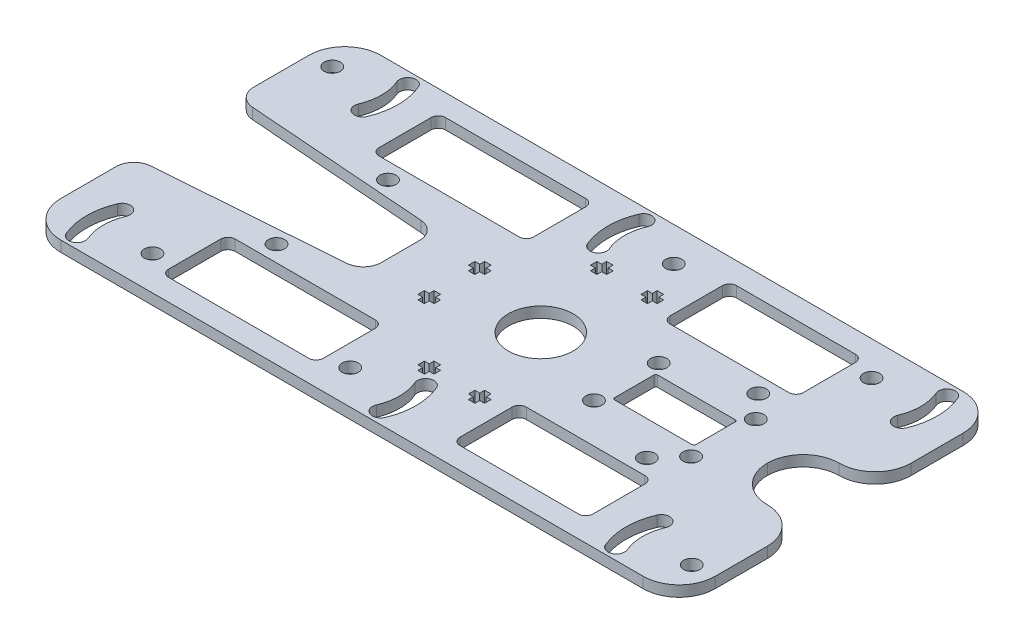
from build123d import *

# Parameters (mm, degrees)
SKETCH1_R           = 9
SKETCH1_R_2         = 2.25
BOSS_EXTRUDE1_DEPTH = 3
CUT_EXTRUDE1_DEPTH  = 109.582917625
FILLET2_START       = -1
FILLET2_DEPTH       = 5
FILLET2_2_DEPTH     = 3
SKETCH6_R           = 2.25
CUT_EXTRUDE2_DEPTH  = 10
CUT_EXTRUDE3_DEPTH  = 10


with BuildPart() as part:
    # Sketch1 → Boss-Extrude1 (new body)
    with BuildSketch(Plane(origin=(0, 0, 0), x_dir=(1, 0, 0), z_dir=(0, 1, 0))):
        with BuildLine():
            Line((83, 10), (83, 34.5))
            ThreePointArc((83, 34.5), (80.071067812, 41.571067812), (73, 44.5))
            Line((73, 44.5), (-89, 44.5))
            ThreePointArc((-89, 44.5), (-96.071067812, 41.571067812), (-99, 34.5))
            Line((-99, 34.5), (-99, 19.13904278))
            ThreePointArc((-99, 19.13904278), (-97.665361422, 15.738289092), (-94.373949741, 14.153046231))
            Line((-94.373949741, 14.153046231), (-43.626050259, 10.346953769))
            ThreePointArc((-43.626050259, 10.346953769), (-40.334638578, 8.761710908), (-39, 5.36095722))
            Line((-39, 5.36095722), (-39, -5.36095722))
            ThreePointArc((-39, -5.36095722), (-40.334638578, -8.761710908), (-43.626050259, -10.346953769))
            Line((-43.626050259, -10.346953769), (-94.373949741, -14.153046231))
            ThreePointArc((-94.373949741, -14.153046231), (-97.665361422, -15.738289092), (-99, -19.13904278))
            Line((-99, -19.13904278), (-99, -34.5))
            ThreePointArc((-99, -34.5), (-96.071067812, -41.571067812), (-89, -44.5))
            Line((-89, -44.5), (73, -44.5))
            ThreePointArc((73, -44.5), (80.071067812, -41.571067812), (83, -34.5))
            Line((83, -34.5), (83, -10))
            Line((83, -10), (63, -10))
            Line((63, -10), (63, 10))
            Line((63, 10), (83, 10))
        make_face()
        with Locations(Location((0, 0, 0), (0, 0, 270))):
            Circle(SKETCH1_R, mode=Mode.SUBTRACT)
        with Locations(Location((77, -35, 0), (0, 0, 270))):
            Circle(SKETCH1_R_2, mode=Mode.SUBTRACT)
        with Locations(Location((45, -15.5, 0), (0, 0, 270))):
            Circle(SKETCH1_R_2, mode=Mode.SUBTRACT)
        with Locations(Location((-18, -35, 0), (0, 0, 270))):
            Circle(SKETCH1_R_2, mode=Mode.SUBTRACT)
        with Locations(Location((45, 15.5, 0), (0, 0, 270))):
            Circle(SKETCH1_R_2, mode=Mode.SUBTRACT)
        with Locations(Location((57, 35, 0), (0, 0, 270))):
            Circle(SKETCH1_R_2, mode=Mode.SUBTRACT)
        with Locations(Location((2, 35, 0), (0, 0, 270))):
            Circle(SKETCH1_R_2, mode=Mode.SUBTRACT)
        with Locations(Location((-58, 15.5, 0), (0, 0, 270))):
            Circle(SKETCH1_R_2, mode=Mode.SUBTRACT)
        with Locations(Location((-58, -15.5, 0), (0, 0, 270))):
            Circle(SKETCH1_R_2, mode=Mode.SUBTRACT)
        with Locations(Location((-73, -35, 0), (0, 0, 270))):
            Circle(SKETCH1_R_2, mode=Mode.SUBTRACT)
        with Locations(Location((-93, 35, 0), (0, 0, 270))):
            Circle(SKETCH1_R_2, mode=Mode.SUBTRACT)
        with BuildLine():
            Line((-26, 20), (-65, 20))
            ThreePointArc((-65, 20), (-66.414213562, 20.585786438), (-67, 22))
            Line((-67, 22), (-67, 36.5))
            ThreePointArc((-67, 36.5), (-66.414213562, 37.914213562), (-65, 38.5))
            Line((-65, 38.5), (-26, 38.5))
            ThreePointArc((-26, 38.5), (-24.585786438, 37.914213562), (-24, 36.5))
            Line((-24, 36.5), (-24, 22))
            ThreePointArc((-24, 22), (-24.585786438, 20.585786438), (-26, 20))
        make_face(mode=Mode.SUBTRACT)
        with BuildLine():
            Line((51, 36.5), (51, 22))
            ThreePointArc((51, 22), (50.414213562, 20.585786438), (49, 20))
            Line((49, 20), (16, 20))
            ThreePointArc((16, 20), (14.585786438, 20.585786438), (14, 22))
            Line((14, 22), (14, 36.5))
            ThreePointArc((14, 36.5), (14.585786438, 37.914213562), (16, 38.5))
            Line((16, 38.5), (49, 38.5))
            ThreePointArc((49, 38.5), (50.414213562, 37.914213562), (51, 36.5))
        make_face(mode=Mode.SUBTRACT)
        with BuildLine():
            Line((49, -38.5), (16, -38.5))
            ThreePointArc((16, -38.5), (14.585786438, -37.914213562), (14, -36.5))
            Line((14, -36.5), (14, -22))
            ThreePointArc((14, -22), (14.585786438, -20.585786438), (16, -20))
            Line((16, -20), (49, -20))
            ThreePointArc((49, -20), (50.414213562, -20.585786438), (51, -22))
            Line((51, -22), (51, -36.5))
            ThreePointArc((51, -36.5), (50.414213562, -37.914213562), (49, -38.5))
        make_face(mode=Mode.SUBTRACT)
        with BuildLine():
            Line((-24, -22), (-24, -36.5))
            ThreePointArc((-24, -36.5), (-24.585786438, -37.914213562), (-26, -38.5))
            Line((-26, -38.5), (-65, -38.5))
            ThreePointArc((-65, -38.5), (-66.414213562, -37.914213562), (-67, -36.5))
            Line((-67, -36.5), (-67, -22))
            ThreePointArc((-67, -22), (-66.414213562, -20.585786438), (-65, -20))
            Line((-65, -20), (-26, -20))
            ThreePointArc((-26, -20), (-24.585786438, -20.585786438), (-24, -22))
        make_face(mode=Mode.SUBTRACT)
        with BuildLine():
            Line((48.6, -5.5), (48.6, 5.5))
            ThreePointArc((48.6, 5.5), (48.453553391, 5.853553391), (48.1, 6))
            Line((48.1, 6), (26.5, 6))
            ThreePointArc((26.5, 6), (26.146446609, 5.853553391), (26, 5.5))
            Line((26, 5.5), (26, -5.5))
            ThreePointArc((26, -5.5), (26.146446609, -5.853553391), (26.5, -6))
            Line((26.5, -6), (48.1, -6))
            ThreePointArc((48.1, -6), (48.453553391, -5.853553391), (48.6, -5.5))
        make_face(mode=Mode.SUBTRACT)
    extrude(amount=BOSS_EXTRUDE1_DEPTH)

    # Sketch2 → Cut-Extrude1 (cut, through all)
    with BuildSketch(Plane(origin=(0, 3, 0), x_dir=(1, 0, 0), z_dir=(0, 1, 0))):
        Polygon((-26.25, 7.929437252), (-26.25, 6.129437252), (-24.9, 6.129437252), (-24.9, 4.779437252), (-23.1, 4.779437252), (-23.1, 6.129437252), (-21.75, 6.129437252), (-21.75, 7.929437252), (-23.1, 7.929437252), (-23.1, 9.279437252), (-24.9, 9.279437252), (-24.9, 7.929437252), align=None)
        Polygon((-24.9, -7.929437252), (-26.25, -7.929437252), (-26.25, -6.129437252), (-24.9, -6.129437252), (-24.9, -4.779437252), (-23.1, -4.779437252), (-23.1, -6.129437252), (-21.75, -6.129437252), (-21.75, -7.929437252), (-23.1, -7.929437252), (-23.1, -9.279437252), (-24.9, -9.279437252), align=None)
        Polygon((7.929437252, 26.25), (6.129437252, 26.25), (6.129437252, 24.9), (4.779437252, 24.9), (4.779437252, 23.1), (6.129437252, 23.1), (6.129437252, 21.75), (7.929437252, 21.75), (7.929437252, 23.1), (9.279437252, 23.1), (9.279437252, 24.9), (7.929437252, 24.9), align=None)
        Polygon((-7.929437252, 24.9), (-7.929437252, 26.25), (-6.129437252, 26.25), (-6.129437252, 24.9), (-4.779437252, 24.9), (-4.779437252, 23.1), (-6.129437252, 23.1), (-6.129437252, 21.75), (-7.929437252, 21.75), (-7.929437252, 23.1), (-9.279437252, 23.1), (-9.279437252, 24.9), align=None)
        Polygon((-7.929437252, -26.25), (-6.129437252, -26.25), (-6.129437252, -24.9), (-4.779437252, -24.9), (-4.779437252, -23.1), (-6.129437252, -23.1), (-6.129437252, -21.75), (-7.929437252, -21.75), (-7.929437252, -23.1), (-9.279437252, -23.1), (-9.279437252, -24.9), (-7.929437252, -24.9), align=None)
        Polygon((7.929437252, -24.9), (7.929437252, -26.25), (6.129437252, -26.25), (6.129437252, -24.9), (4.779437252, -24.9), (4.779437252, -23.1), (6.129437252, -23.1), (6.129437252, -21.75), (7.929437252, -21.75), (7.929437252, -23.1), (9.279437252, -23.1), (9.279437252, -24.9), align=None)
    extrude(amount=-CUT_EXTRUDE1_DEPTH, mode=Mode.SUBTRACT)

    # Fillet2: read off the stored shape, not the designer's step
    # Fillet2 outline → Fillet2 (cut)
    with BuildSketch(Plane(origin=(0, 0, 0), x_dir=(1, 0, 0), z_dir=(0, 1, 0)).offset(FILLET2_START)):
        with BuildLine():
            Line((83, 10), (83, 20))
            ThreePointArc((83, 20), (80.071067812, 12.928932188), (73, 10))
            Line((73, 10), (83, 10))
        make_face()
        with BuildLine():
            Line((83, -10), (73, -10))
            ThreePointArc((73, -10), (80.071067812, -12.928932188), (83, -20))
            Line((83, -20), (83, -10))
        make_face()
    extrude(amount=FILLET2_DEPTH, mode=Mode.SUBTRACT)

    # Fillet2 2 outline → Fillet2 2 (add)
    with BuildSketch(Plane(origin=(0, 0, 0), x_dir=(1, 0, 0), z_dir=(0, 1, 0))):
        with BuildLine():
            ThreePointArc((73, -10), (65.928932188, -7.071067812), (63, 0))
            Line((63, 0), (63, -10))
            Line((63, -10), (73, -10))
        make_face()
        with BuildLine():
            ThreePointArc((63, 0), (65.928932188, 7.071067812), (73, 10))
            Line((73, 10), (63, 10))
            Line((63, 10), (63, 0))
        make_face()
    extrude(amount=FILLET2_2_DEPTH)

    # Sketch6 → Cut-Extrude2 (cut)
    with BuildSketch(Plane(origin=(0, 3, 0), x_dir=(1, 0, 0), z_dir=(0, 1, 0))):
        with Locations(Location((23.8, 9, 0), (0, 0, 270))):
            Circle(SKETCH6_R)
        with Locations(Location((50.8, 9, 0), (0, 0, 270))):
            Circle(SKETCH6_R)
        with Locations(Location((50.8, -9, 0), (0, 0, 270))):
            Circle(SKETCH6_R)
        with Locations(Location((23.8, -9, 0), (0, 0, 270))):
            Circle(SKETCH6_R)
    extrude(amount=-CUT_EXTRUDE2_DEPTH, mode=Mode.SUBTRACT)

    # Sketch7 → Cut-Extrude3 (cut)
    with BuildSketch(Plane(origin=(0, 3, 0), x_dir=(1, 0, 0), z_dir=(0, 1, 0))):
        with BuildLine():
            ThreePointArc((-85.610916492, -29.64698354), (-86.7, -35), (-85.610916492, -40.35301646))
            ThreePointArc((-85.610916492, -40.35301646), (-86.82939606, -43.368859219), (-89.845238818, -42.150379651))
            ThreePointArc((-89.845238818, -42.150379651), (-91.3, -35), (-89.845238818, -27.849620349))
            ThreePointArc((-89.845238818, -27.849620349), (-86.82939606, -26.631140781), (-85.610916492, -29.64698354))
        make_face()
        with BuildLine():
            ThreePointArc((-1.154761182, -27.849620349), (-4.17060394, -26.631140781), (-5.389083508, -29.64698354))
            ThreePointArc((-5.389083508, -29.64698354), (-4.3, -35), (-5.389083508, -40.35301646))
            ThreePointArc((-5.389083508, -40.35301646), (-4.17060394, -43.368859219), (-1.154761182, -42.150379651))
            ThreePointArc((-1.154761182, -42.150379651), (0.3, -35), (-1.154761182, -27.849620349))
        make_face()
        with BuildLine():
            ThreePointArc((60.154760977, -27.849620349), (58.699999715, -35.000000016), (60.154760977, -42.150379651))
            ThreePointArc((60.154760977, -42.150379651), (63.170603735, -43.368859219), (64.389083303, -40.35301646))
            ThreePointArc((64.389083303, -40.35301646), (63.299999715, -35.000000016), (64.389083303, -29.64698354))
            ThreePointArc((64.389083303, -29.64698354), (63.170603735, -26.631140781), (60.154760977, -27.849620349))
        make_face()
        with BuildLine():
            ThreePointArc((69.610916492, 29.64698354), (70.7, 35), (69.610916492, 40.35301646))
            ThreePointArc((69.610916492, 40.35301646), (70.82939606, 43.368859219), (73.845238818, 42.150379651))
            ThreePointArc((73.845238818, 42.150379651), (75.3, 35), (73.845238818, 27.849620349))
            ThreePointArc((73.845238818, 27.849620349), (70.82939606, 26.631140781), (69.610916492, 29.64698354))
        make_face()
        with BuildLine():
            ThreePointArc((-14.845238818, 27.849620349), (-11.82939606, 26.631140781), (-10.610916492, 29.64698354))
            ThreePointArc((-10.610916492, 29.64698354), (-11.7, 35), (-10.610916492, 40.35301646))
            ThreePointArc((-10.610916492, 40.35301646), (-11.82939606, 43.368859219), (-14.845238818, 42.150379651))
            ThreePointArc((-14.845238818, 42.150379651), (-16.3, 35), (-14.845238818, 27.849620349))
        make_face()
        with BuildLine():
            ThreePointArc((-76.154760977, 27.849620349), (-74.699999715, 35.000000016), (-76.154760977, 42.150379651))
            ThreePointArc((-76.154760977, 42.150379651), (-79.170603735, 43.368859219), (-80.389083303, 40.35301646))
            ThreePointArc((-80.389083303, 40.35301646), (-79.299999715, 35.000000016), (-80.389083303, 29.64698354))
            ThreePointArc((-80.389083303, 29.64698354), (-79.170603735, 26.631140781), (-76.154760977, 27.849620349))
        make_face()
    extrude(amount=-CUT_EXTRUDE3_DEPTH, mode=Mode.SUBTRACT)


solid = part.part
